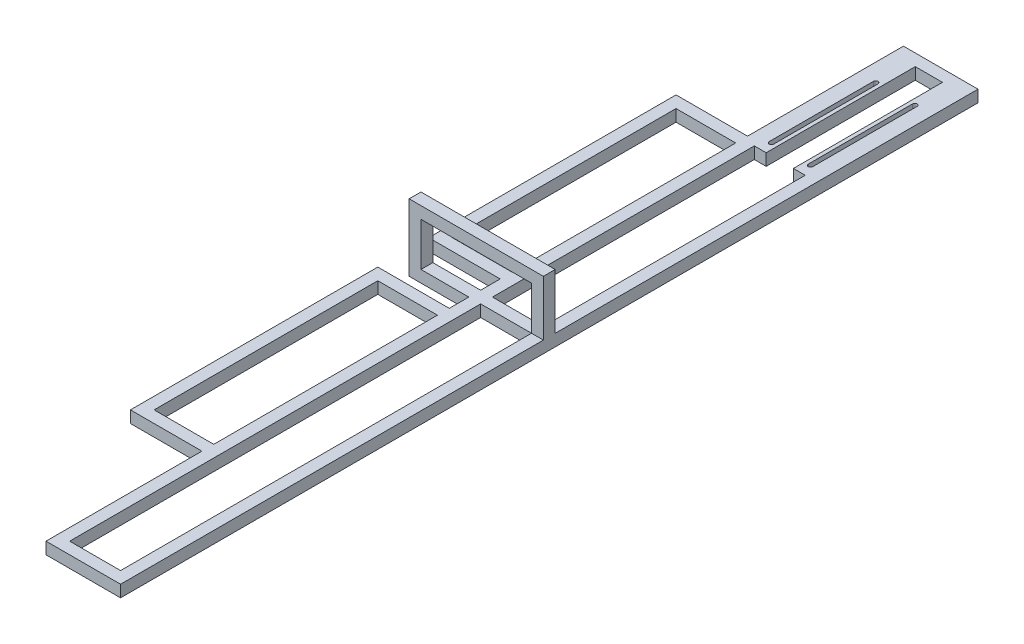
from build123d import *

# Parameters (mm, degrees)
SKETCH1_W           = 100
SKETCH1_H           = 1150
SKETCH1_W_2         = 68.25
SKETCH1_H_2         = 1118.25
BOSS_EXTRUDE1_DEPTH = 15.875
SKETCH3_W           = 111.75
SKETCH3_H           = 331.75
SKETCH3_W_2         = 80
SKETCH3_H_2         = 300
BOSS_EXTRUDE2_DEPTH = 15.875
SKETCH5_W           = 180
SKETCH5_H           = 90
SKETCH5_W_2         = 148.25
SKETCH5_H_2         = 58.25
BOSS_EXTRUDE3_DEPTH = 7.9375
SKETCH6_W           = 15.875
SKETCH6_H           = 200
BOSS_EXTRUDE4_DEPTH = 15.875
CUT_EXTRUDE1_DEPTH  = 15.875


with BuildPart() as part:
    # Sketch1 → Boss-Extrude1 (new body)
    with BuildSketch(Plane(origin=(0, 0, 0), x_dir=(1, 0, 0), z_dir=(0, 1, 0))):
        Rectangle(SKETCH1_W, SKETCH1_H)
        Rectangle(SKETCH1_W_2, SKETCH1_H_2, mode=Mode.SUBTRACT)
    extrude(amount=BOSS_EXTRUDE1_DEPTH)

    # Sketch3 → Boss-Extrude2 (add)
    # profile 1 of 2: a face of its own
    with BuildSketch(Plane(origin=(0, 15.875, 0), x_dir=(1, 0, 0), z_dir=(0, 1, 0))):
        with Locations((-90, 200)):
            Rectangle(SKETCH3_W, SKETCH3_H)
        with Locations((-90, 200)):
            Rectangle(SKETCH3_W_2, SKETCH3_H_2, mode=Mode.SUBTRACT)
    # profile 2 of 2: a face of its own
    with BuildSketch(Plane(origin=(0, 15.875, 0), x_dir=(1, 0, 0), z_dir=(0, 1, 0))):
        with Locations((-90, -200)):
            Rectangle(SKETCH3_W, SKETCH3_H)
        with Locations((-90, -200)):
            Rectangle(SKETCH3_W_2, SKETCH3_H_2, mode=Mode.SUBTRACT)
    extrude(amount=-BOSS_EXTRUDE2_DEPTH)

    # Sketch5 → Boss-Extrude3 (add, symmetric)
    with BuildSketch(Plane.XY):
        with Locations((-40, 45)):
            Rectangle(SKETCH5_W, SKETCH5_H)
        with Locations((-40, 45)):
            Rectangle(SKETCH5_W_2, SKETCH5_H_2, mode=Mode.SUBTRACT)
    extrude(amount=BOSS_EXTRUDE3_DEPTH, both=True)

    # Sketch6 → Boss-Extrude4 (add)
    with BuildSketch(Plane.XZ):
        with Locations((-26.1875, -459.125)):
            Rectangle(SKETCH6_W, SKETCH6_H)
        with Locations((26.1875, -459.125)):
            Rectangle(SKETCH6_W, SKETCH6_H)
    extrude(amount=-BOSS_EXTRUDE4_DEPTH)

    # Sketch7 → Cut-Extrude1 (cut)
    with BuildSketch(Plane.XZ):
        with BuildLine():
            Line((-23.1875, -374.125), (-23.1875, -514.125))
            ThreePointArc((-23.1875, -514.125), (-26.1875, -517.125), (-29.1875, -514.125))
            Line((-29.1875, -514.125), (-29.1875, -374.125))
            ThreePointArc((-29.1875, -374.125), (-26.1875, -371.125), (-23.1875, -374.125))
        make_face()
        with BuildLine():
            Line((29.1875, -374.125), (29.1875, -514.125))
            ThreePointArc((29.1875, -514.125), (26.1875, -517.125), (23.1875, -514.125))
            Line((23.1875, -514.125), (23.1875, -374.125))
            ThreePointArc((23.1875, -374.125), (26.1875, -371.125), (29.1875, -374.125))
        make_face()
    extrude(amount=-CUT_EXTRUDE1_DEPTH, mode=Mode.SUBTRACT)


solid = part.part
